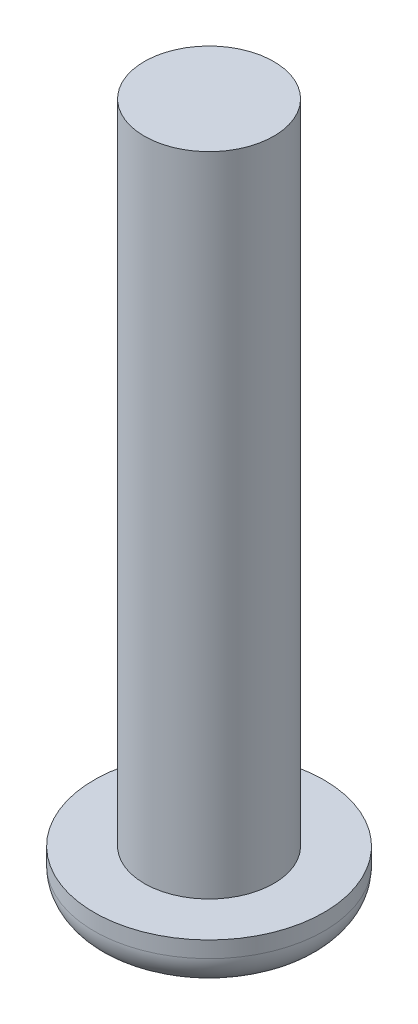
from build123d import *

# Parameters (mm, degrees)
SKETCH1_R           = 4
BOSS_EXTRUDE1_DEPTH = 40
SKETCH2_R           = 7.1
BOSS_EXTRUDE2_DEPTH = 3
FILLET1_R           = 2
CUT_EXTRUDE1_DEPTH  = 1
CUT_EXTRUDE1_DRAFT  = -15


with BuildPart() as part:
    # Sketch1 → Boss-Extrude1 (new body)
    with BuildSketch(Plane(origin=(0, 0, 0), x_dir=(1, 0, 0), z_dir=(0, 1, 0))):
        Circle(SKETCH1_R)
    extrude(amount=BOSS_EXTRUDE1_DEPTH)

    # Sketch2 → Boss-Extrude2 (add)
    with BuildSketch(Plane.XZ):
        Circle(SKETCH2_R)
    extrude(amount=BOSS_EXTRUDE2_DEPTH)

    # Fillet1
    fillet1_edges = [part.edges().sort_by_distance(p)[0] for p in [
        (-7.1, -3, 0),
    ]]
    fillet(fillet1_edges, radius=FILLET1_R)


with BuildPart() as cut_extrude1_tool:
    # Sketch3 → Cut-Extrude1 (with draft: the straight prism first)
    with BuildSketch(Plane.XZ.offset(3)):
        Polygon((0.375, 0.375), (0.375, 1.5), (-0.375, 1.5), (-0.375, 0.375), (-1.5, 0.375), (-1.5, -0.375), (-0.375, -0.375), (-0.375, -1.5), (0.375, -1.5), (0.375, -0.375), (1.5, -0.375), (1.5, 0.375), align=None)
    extrude(amount=-CUT_EXTRUDE1_DEPTH)
    # Cut-Extrude1: the draft: its side faces are tilted about the plane it starts from
    cut_extrude1_sides = [cut_extrude1_tool.faces().sort_by_distance(p)[0] for p in [
        (0.375, -2.5, 0.9375),
        (0, -2.5, 1.5),
        (-0.375, -2.5, 0.9375),
        (-0.9375, -2.5, 0.375),
        (-1.5, -2.5, 0),
        (-0.9375, -2.5, -0.375),
        (-0.375, -2.5, -0.9375),
        (0, -2.5, -1.5),
        (0.375, -2.5, -0.9375),
        (0.9375, -2.5, -0.375),
        (1.5, -2.5, 0),
        (0.9375, -2.5, 0.375),
    ]]
    draft(cut_extrude1_sides, Plane.XZ.offset(3), CUT_EXTRUDE1_DRAFT)


with BuildPart() as part_1:
    add(part.part)

    # Cut-Extrude1: cut by cut_extrude1_tool
    add(cut_extrude1_tool.part, mode=Mode.SUBTRACT)


solid = part_1.part
